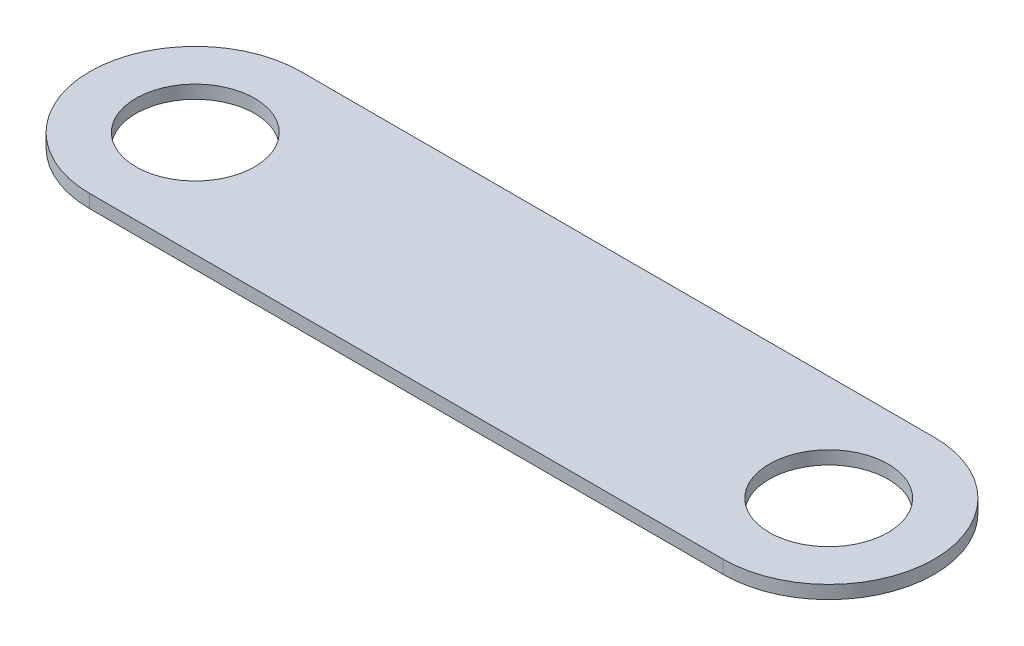
from build123d import *

# Parameters (mm, degrees)
SKETCH1_R           = 14.2875
BOSS_EXTRUDE1_DEPTH = 3.175


with BuildPart() as part:
    # Sketch1 → Boss-Extrude1 (new body)
    with BuildSketch(Plane(origin=(0, 0, 0), x_dir=(1, 0, 0), z_dir=(0, 1, 0))):
        with BuildLine():
            Line((0, 25.4), (152.4, 25.4))
            ThreePointArc((152.4, 25.4), (177.8, 0), (152.4, -25.4))
            Line((152.4, -25.4), (0, -25.4))
            ThreePointArc((0, -25.4), (-25.4, 0), (0, 25.4))
        make_face()
        Circle(SKETCH1_R, mode=Mode.SUBTRACT)
        with Locations((152.4, 0)):
            Circle(SKETCH1_R, mode=Mode.SUBTRACT)
    extrude(amount=BOSS_EXTRUDE1_DEPTH)


solid = part.part
